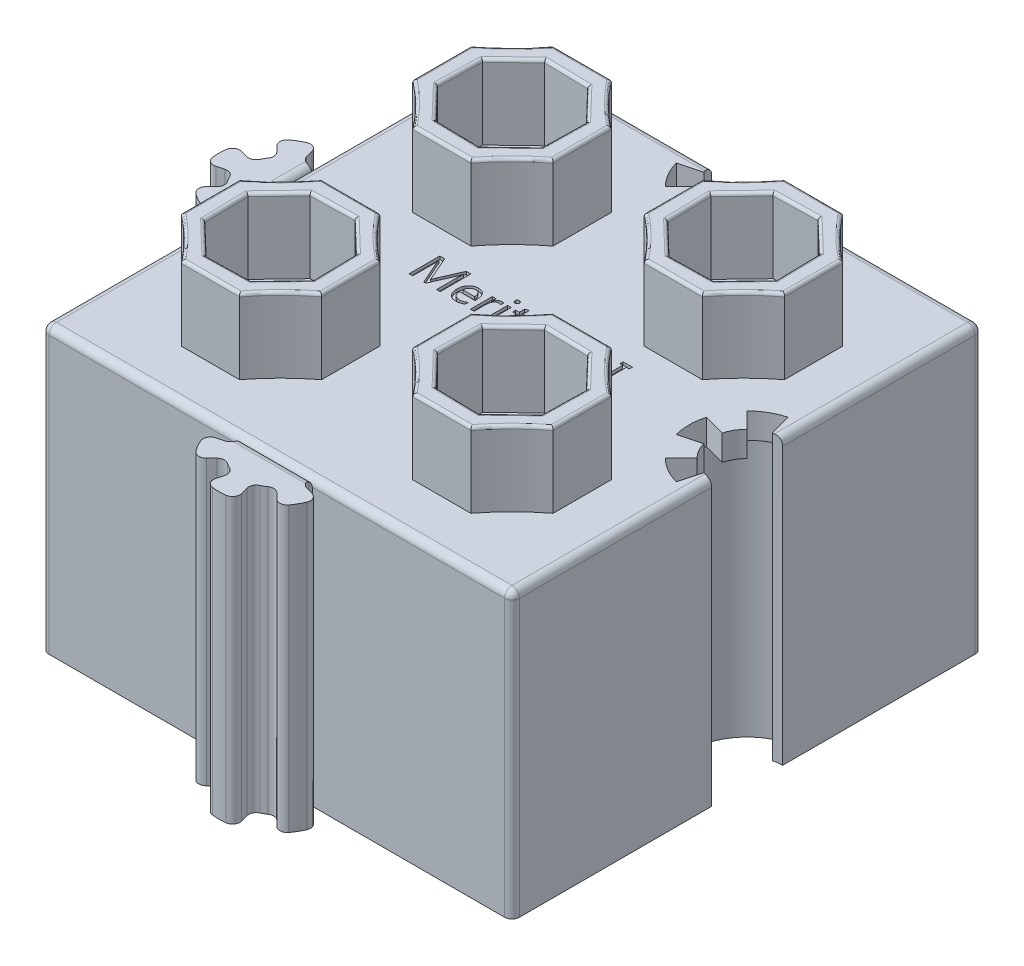
from build123d import *

# Parameters (mm, degrees)
SKETCH2_W           = 31.5
SKETCH2_H           = 31.5
BOSS_EXTRUDE1_DEPTH = 19
CUT_EXTRUDE6_DEPTH  = 30.276697218
BOSS_EXTRUDE5_DEPTH = 5
CUT_EXTRUDE8_START  = -17.3
CUT_EXTRUDE8_DEPTH  = 17.3
FILLET19_R          = 0.1
FILLET20_R          = 0.5
FILLET21_R          = 0.2
BOSS_EXTRUDE7_DEPTH = 19
FILLET24_R          = 0.5
BOSS_EXTRUDE9_START = -0.5
BOSS_EXTRUDE9_DEPTH = 18.5
FILLET31_R          = 0.5
SKETCH14_W          = 0.243314401
SKETCH14_H          = 1.459886411
CUT_EXTRUDE9_DEPTH  = 0.2


with BuildPart() as part:
    # Sketch2 → Boss-Extrude1 (new body)
    with BuildSketch(Plane(origin=(0, 0, 0), x_dir=(1, 0, 0), z_dir=(0, 1, 0))):
        Rectangle(SKETCH2_W, SKETCH2_H)
    extrude(amount=BOSS_EXTRUDE1_DEPTH)

    # Sketch5 → Cut-Extrude6 (cut, through all)
    with BuildSketch(Plane(origin=(0, 19, 0), x_dir=(1, 0, 0), z_dir=(0, 1, 0))):
        with BuildLine():
            Line((-2.740038777, 13.009961223), (-1.679378605, 14.070621395))
            ThreePointArc((-1.679378605, 14.070621395), (-2.056810334, 14.5625), (-2.294073837, 15.135304768))
            Line((-2.294073837, 15.135304768), (-3.742962577, 14.7470762))
            ThreePointArc((-3.742962577, 14.7470762), (-3.35584844, 13.8125), (-2.740038777, 13.009961223))
        make_face()
        with BuildLine():
            Line((1.0029238, 12.007037423), (0.614695232, 13.455926163))
            ThreePointArc((0.614695232, 13.455926163), (0, 13.375), (-0.614695232, 13.455926163))
            Line((-0.614695232, 13.455926163), (-1.0029238, 12.007037423))
            ThreePointArc((-1.0029238, 12.007037423), (0, 11.875), (1.0029238, 12.007037423))
        make_face()
        with BuildLine():
            ThreePointArc((2.294073837, 15.135304768), (2.056810334, 14.5625), (1.679378605, 14.070621395))
            Line((1.679378605, 14.070621395), (2.740038777, 13.009961223))
            ThreePointArc((2.740038777, 13.009961223), (3.35584844, 13.8125), (3.742962577, 14.7470762))
            Line((3.742962577, 14.7470762), (2.294073837, 15.135304768))
        make_face()
        with BuildLine():
            ThreePointArc((-0.614695232, 13.455926163), (0, 13.375), (0.614695232, 13.455926163))
            ThreePointArc((0.614695232, 13.455926163), (1.1875, 13.693189666), (1.679378605, 14.070621395))
            ThreePointArc((1.679378605, 14.070621395), (2.056810334, 14.5625), (2.294073837, 15.135304768))
            ThreePointArc((2.294073837, 15.135304768), (2.354681546, 15.440000293), (2.375, 15.75))
            Line((2.375, 15.75), (0, 15.75))
            Line((0, 15.75), (-2.375, 15.75))
            ThreePointArc((-2.375, 15.75), (-2.354681546, 15.440000293), (-2.294073837, 15.135304768))
            ThreePointArc((-2.294073837, 15.135304768), (-2.056810334, 14.5625), (-1.679378605, 14.070621395))
            ThreePointArc((-1.679378605, 14.070621395), (-1.1875, 13.693189666), (-0.614695232, 13.455926163))
        make_face()
        with BuildLine():
            Line((15.75, -2.375), (15.75, 0))
            Line((15.75, 0), (15.75, 2.375))
            ThreePointArc((15.75, 2.375), (15.440000293, 2.354681546), (15.135304768, 2.294073837))
            ThreePointArc((15.135304768, 2.294073837), (14.5625, 2.056810334), (14.070621395, 1.679378605))
            ThreePointArc((14.070621395, 1.679378605), (13.693189666, 1.1875), (13.455926163, 0.614695232))
            ThreePointArc((13.455926163, 0.614695232), (13.375, 0), (13.455926163, -0.614695232))
            ThreePointArc((13.455926163, -0.614695232), (13.693189666, -1.1875), (14.070621395, -1.679378605))
            ThreePointArc((14.070621395, -1.679378605), (14.5625, -2.056810334), (15.135304768, -2.294073837))
            ThreePointArc((15.135304768, -2.294073837), (15.440000293, -2.354681546), (15.75, -2.375))
        make_face()
        with BuildLine():
            ThreePointArc((14.070621395, 1.679378605), (14.5625, 2.056810334), (15.135304768, 2.294073837))
            Line((15.135304768, 2.294073837), (14.7470762, 3.742962577))
            ThreePointArc((14.7470762, 3.742962577), (13.8125, 3.35584844), (13.009961223, 2.740038777))
            Line((13.009961223, 2.740038777), (14.070621395, 1.679378605))
        make_face()
        with BuildLine():
            Line((12.007037423, -1.0029238), (13.455926163, -0.614695232))
            ThreePointArc((13.455926163, -0.614695232), (13.375, 0), (13.455926163, 0.614695232))
            Line((13.455926163, 0.614695232), (12.007037423, 1.0029238))
            ThreePointArc((12.007037423, 1.0029238), (11.875, 0), (12.007037423, -1.0029238))
        make_face()
        with BuildLine():
            Line((14.7470762, -3.742962577), (15.135304768, -2.294073837))
            ThreePointArc((15.135304768, -2.294073837), (14.5625, -2.056810334), (14.070621395, -1.679378605))
            Line((14.070621395, -1.679378605), (13.009961223, -2.740038777))
            ThreePointArc((13.009961223, -2.740038777), (13.8125, -3.35584844), (14.7470762, -3.742962577))
        make_face()
    extrude(amount=-CUT_EXTRUDE6_DEPTH, mode=Mode.SUBTRACT)

    # Sketch3 → Boss-Extrude5 (add)
    # profile 1 of 4: a face of its own
    with BuildSketch(Plane(origin=(0, 19, 0), x_dir=(1, 0, 0), z_dir=(0, 1, 0))):
        with BuildLine():
            Line((-9.696803743, -3.05), (-5.803196257, -3.05))
            ThreePointArc((-5.803196257, -3.05), (-4.516309736, -4.516309736), (-3.05, -5.803196257))
            Line((-3.05, -5.803196257), (-3.05, -9.696803743))
            ThreePointArc((-3.05, -9.696803743), (-4.516309736, -10.983690264), (-5.803196257, -12.45))
            Line((-5.803196257, -12.45), (-9.696803743, -12.45))
            ThreePointArc((-9.696803743, -12.45), (-10.983690264, -10.983690264), (-12.45, -9.696803743))
            Line((-12.45, -9.696803743), (-12.45, -5.803196257))
            ThreePointArc((-12.45, -5.803196257), (-10.983690264, -4.516309736), (-9.696803743, -3.05))
        make_face()
        Polygon((-9.29596592, -4.228191333), (-6.352868195, -4.166542224), (-4.228191333, -6.20403408), (-4.166542224, -9.147131805), (-6.20403408, -11.271808667), (-9.147131805, -11.333457776), (-11.271808667, -9.29596592), (-11.333457776, -6.352868195), align=None, mode=Mode.SUBTRACT)
    # profile 2 of 4: a face of its own
    with BuildSketch(Plane(origin=(0, 19, 0), x_dir=(1, 0, 0), z_dir=(0, 1, 0))):
        with BuildLine():
            Line((-3.05, 5.803196257), (-3.05, 9.696803743))
            ThreePointArc((-3.05, 9.696803743), (-4.516309736, 10.983690264), (-5.803196257, 12.45))
            Line((-5.803196257, 12.45), (-9.696803743, 12.45))
            ThreePointArc((-9.696803743, 12.45), (-10.983690264, 10.983690264), (-12.45, 9.696803743))
            Line((-12.45, 9.696803743), (-12.45, 5.803196257))
            ThreePointArc((-12.45, 5.803196257), (-10.983690264, 4.516309736), (-9.696803743, 3.05))
            Line((-9.696803743, 3.05), (-5.803196257, 3.05))
            ThreePointArc((-5.803196257, 3.05), (-4.516309736, 4.516309736), (-3.05, 5.803196257))
        make_face()
        Polygon((-6.352868195, 4.166542224), (-4.228191333, 6.20403408), (-4.166542224, 9.147131805), (-6.20403408, 11.271808667), (-9.147131805, 11.333457776), (-11.271808667, 9.29596592), (-11.333457776, 6.352868195), (-9.29596592, 4.228191333), align=None, mode=Mode.SUBTRACT)
    # profile 3 of 4: a face of its own
    with BuildSketch(Plane(origin=(0, 19, 0), x_dir=(1, 0, 0), z_dir=(0, 1, 0))):
        with BuildLine():
            Line((3.05, -5.803196257), (3.05, -9.696803743))
            ThreePointArc((3.05, -9.696803743), (4.516309736, -10.983690264), (5.803196257, -12.45))
            Line((5.803196257, -12.45), (9.696803743, -12.45))
            ThreePointArc((9.696803743, -12.45), (10.983690264, -10.983690264), (12.45, -9.696803743))
            Line((12.45, -9.696803743), (12.45, -5.803196257))
            ThreePointArc((12.45, -5.803196257), (10.983690264, -4.516309736), (9.696803743, -3.05))
            Line((9.696803743, -3.05), (5.803196257, -3.05))
            ThreePointArc((5.803196257, -3.05), (4.516309736, -4.516309736), (3.05, -5.803196257))
        make_face()
        Polygon((6.352868195, -4.166542224), (4.228191333, -6.20403408), (4.166542224, -9.147131805), (6.20403408, -11.271808667), (9.147131805, -11.333457776), (11.271808667, -9.29596592), (11.333457776, -6.352868195), (9.29596592, -4.228191333), align=None, mode=Mode.SUBTRACT)
    # profile 4 of 4: a face of its own
    with BuildSketch(Plane(origin=(0, 19, 0), x_dir=(1, 0, 0), z_dir=(0, 1, 0))):
        with BuildLine():
            Line((9.696803743, 3.05), (5.803196257, 3.05))
            ThreePointArc((5.803196257, 3.05), (4.516309736, 4.516309736), (3.05, 5.803196257))
            Line((3.05, 5.803196257), (3.05, 9.696803743))
            ThreePointArc((3.05, 9.696803743), (4.516309736, 10.983690264), (5.803196257, 12.45))
            Line((5.803196257, 12.45), (9.696803743, 12.45))
            ThreePointArc((9.696803743, 12.45), (10.983690264, 10.983690264), (12.45, 9.696803743))
            Line((12.45, 9.696803743), (12.45, 5.803196257))
            ThreePointArc((12.45, 5.803196257), (10.983690264, 4.516309736), (9.696803743, 3.05))
        make_face()
        Polygon((9.29596592, 4.228191333), (6.352868195, 4.166542224), (4.228191333, 6.20403408), (4.166542224, 9.147131805), (6.20403408, 11.271808667), (9.147131805, 11.333457776), (11.271808667, 9.29596592), (11.333457776, 6.352868195), align=None, mode=Mode.SUBTRACT)
    extrude(amount=BOSS_EXTRUDE5_DEPTH)

    # Sketch7 → Cut-Extrude8 (cut)
    with BuildSketch(Plane.XZ.offset(CUT_EXTRUDE8_START)):
        Polygon((-8.175, 14.3), (-14.3, 14.3), (-14.3, 8.175), (-12.95, 8.175), (-12.95, 6.725), (-14.3, 6.725), (-14.3, 0.6), (-8.175, 0.6), (-8.175, 3.2), (-7.45, 3.2), (-6.725, 3.2), (-6.725, 0.6), (-0.55600988, 0.6), (-0.55600988, 6.725), (-3.2, 6.725), (-3.2, 7.45), (-3.2, 8.175), (-0.55600988, 8.175), (-0.55600988, 14.3), (-6.725, 14.3), (-6.725, 12.95), (-8.175, 12.95), align=None)
        Polygon((6.721665956, 14.3), (0.6, 14.3), (0.6, 8.175), (3.2, 8.175), (3.2, 7.45), (3.2, 6.725), (0.6, 6.725), (0.6, 0.6), (6.725, 0.6), (6.725, 3.2), (7.45, 3.2), (8.175, 3.2), (8.175, 0.6), (14.3, 0.6), (14.3, 6.725), (12.95, 6.725), (12.95, 7.45), (12.95, 8.175), (14.3, 8.175), (14.3, 14.3), (8.171665956, 14.3), (8.171665956, 12.95), (6.721665956, 12.95), align=None)
        with BuildLine():
            ThreePointArc((12.007037423, -1.0029238), (11.959028537, -0.802596019), (11.921733421, -0.6))
            Line((11.921733421, -0.6), (8.175, -0.6))
            Line((8.175, -0.6), (8.175, -3.2))
            Line((8.175, -3.2), (6.725, -3.2))
            Line((6.725, -3.2), (6.725, -0.6))
            Line((6.725, -0.6), (0.6, -0.6))
            Line((0.6, -0.6), (0.6, -6.725))
            Line((0.6, -6.725), (3.2, -6.725))
            Line((3.2, -6.725), (3.2, -7.45))
            Line((3.2, -7.45), (3.2, -8.175))
            Line((3.2, -8.175), (0.6, -8.175))
            Line((0.6, -8.175), (0.6, -11.921733421))
            ThreePointArc((0.6, -11.921733421), (0.802596019, -11.959028537), (1.0029238, -12.007037423))
            Line((1.0029238, -12.007037423), (0.614695232, -13.455926163))
            ThreePointArc((0.614695232, -13.455926163), (1.1875, -13.693189666), (1.679378605, -14.070621395))
            Line((1.679378605, -14.070621395), (2.740038777, -13.009961223))
            ThreePointArc((2.740038777, -13.009961223), (3.231783828, -13.611963917), (3.593483686, -14.3))
            Line((3.593483686, -14.3), (3.825102639, -14.3))
            Line((3.825102639, -14.3), (6.721665956, -14.3))
            Line((6.721665956, -14.3), (6.721665956, -12.95))
            Line((6.721665956, -12.95), (8.171665956, -12.95))
            Line((8.171665956, -12.95), (8.171665956, -14.3))
            Line((8.171665956, -14.3), (14.3, -14.3))
            Line((14.3, -14.3), (14.3, -8.175))
            Line((14.3, -8.175), (12.95, -8.175))
            Line((12.95, -8.175), (12.95, -7.45))
            Line((12.95, -7.45), (12.95, -6.725))
            Line((12.95, -6.725), (14.3, -6.725))
            Line((14.3, -6.725), (14.3, -3.593483686))
            ThreePointArc((14.3, -3.593483686), (13.611963917, -3.231783828), (13.009961223, -2.740038777))
            Line((13.009961223, -2.740038777), (14.070621395, -1.679378605))
            ThreePointArc((14.070621395, -1.679378605), (13.693189666, -1.1875), (13.455926163, -0.614695232))
            Line((13.455926163, -0.614695232), (12.007037423, -1.0029238))
        make_face()
        with BuildLine():
            Line((-6.725, -14.3), (-3.593483686, -14.3))
            ThreePointArc((-3.593483686, -14.3), (-3.231783828, -13.611963917), (-2.740038777, -13.009961223))
            Line((-2.740038777, -13.009961223), (-1.679378605, -14.070621395))
            ThreePointArc((-1.679378605, -14.070621395), (-1.1875, -13.693189666), (-0.614695232, -13.455926163))
            Line((-0.614695232, -13.455926163), (-1.0029238, -12.007037423))
            ThreePointArc((-1.0029238, -12.007037423), (-0.780821232, -11.954483803), (-0.55600988, -11.915097392))
            Line((-0.55600988, -11.915097392), (-0.55600988, -8.175))
            Line((-0.55600988, -8.175), (-3.2, -8.175))
            Line((-3.2, -8.175), (-3.2, -7.45))
            Line((-3.2, -7.45), (-3.2, -6.725))
            Line((-3.2, -6.725), (-0.55600988, -6.725))
            Line((-0.55600988, -6.725), (-0.55600988, -0.6))
            Line((-0.55600988, -0.6), (-6.725, -0.6))
            Line((-6.725, -0.6), (-6.725, -3.2))
            Line((-6.725, -3.2), (-8.175, -3.2))
            Line((-8.175, -3.2), (-8.175, -0.6))
            Line((-8.175, -0.6), (-14.3, -0.6))
            Line((-14.3, -0.6), (-14.3, -5.275))
            Line((-14.3, -5.275), (-14.3, -6.725))
            Line((-14.3, -6.725), (-12.95, -6.725))
            Line((-12.95, -6.725), (-12.95, -7.45))
            Line((-12.95, -7.45), (-12.95, -8.175))
            Line((-12.95, -8.175), (-14.3, -8.175))
            Line((-14.3, -8.175), (-14.3, -14.3))
            Line((-14.3, -14.3), (-8.175, -14.3))
            Line((-8.175, -14.3), (-8.175, -12.95))
            Line((-8.175, -12.95), (-6.725, -12.95))
            Line((-6.725, -12.95), (-6.725, -14.3))
        make_face()
    extrude(amount=CUT_EXTRUDE8_DEPTH, mode=Mode.SUBTRACT)

    # Fillet19
    fillet19_edges = [part.edges().sort_by_distance(p)[0] for p in [
        (-3.2, 0, -7.45),
        (-3.2, 8.65, -6.725),
        (-3.2, 8.65, -8.175),
        (-6.725, 8.65, -12.95),
        (-8.175, 8.65, -12.95),
        (-12.95, 0, -7.45),
        (-12.95, 8.65, -8.175),
        (-12.95, 8.65, -6.725),
        (-8.175, 8.65, -3.2),
        (-6.725, 8.65, -3.2),
        (-7.45, 0, -3.2),
        (-7.45, 0, -12.95),
        (7.446665956, 0, -12.95),
        (8.171665956, 8.65, -12.95),
        (6.721665956, 8.65, -12.95),
        (3.2, 8.65, -8.175),
        (3.2, 8.65, -6.725),
        (7.45, 0, -3.2),
        (6.725, 8.65, -3.2),
        (8.175, 8.65, -3.2),
        (12.95, 8.65, -6.725),
        (12.95, 8.65, -8.175),
        (12.95, 0, -7.45),
        (3.2, 0, -7.45),
        (7.45, 0, 3.2),
        (8.175, 8.65, 3.2),
        (6.725, 8.65, 3.2),
        (3.2, 8.65, 6.725),
        (3.2, 8.65, 8.175),
        (6.721665956, 8.65, 12.95),
        (8.171665956, 8.65, 12.95),
        (12.95, 8.65, 8.175),
        (12.95, 8.65, 6.725),
        (12.95, 0, 7.45),
        (7.446665956, 0, 12.95),
        (3.2, 0, 7.45),
        (-12.95, 0, 7.45),
        (-12.95, 8.65, 6.725),
        (-12.95, 8.65, 8.175),
        (-7.45, 0, 12.95),
        (-8.175, 8.65, 12.95),
        (-6.725, 8.65, 12.95),
        (-3.2, 0, 7.45),
        (-3.2, 8.65, 8.175),
        (-3.2, 8.65, 6.725),
        (-7.45, 0, 3.2),
        (-6.725, 8.65, 3.2),
        (-8.175, 8.65, 3.2),
    ]]
    fillet(fillet19_edges, radius=FILLET19_R)

    # Fillet20
    fillet20_edges = [part.edges().sort_by_distance(p)[0] for p in [
        (-15.75, 19, 0),
        (0, 19, 15.75),
        (15.75, 19, -9.0625),
        (-9.0625, 19, -15.75),
        (15.75, 19, 9.0625),
        (15.75, 9.5, 15.75),
        (-15.75, 9.5, 15.75),
        (-15.75, 9.5, -15.75),
        (15.75, 9.5, -15.75),
        (9.0625, 19, -15.75),
    ]]
    fillet(fillet20_edges, radius=FILLET20_R)

    # Fillet21
    fillet21_edges = [part.edges().sort_by_distance(p)[0] for p in [
        (-4.516309736, 24, 4.516309736),
        (-7.75, 24, 3.05),
        (-10.983690264, 24, 4.516309736),
        (-12.45, 24, 7.75),
        (-10.983690264, 24, 10.983690264),
        (-7.75, 24, 12.45),
        (-4.516309736, 24, 10.983690264),
        (-3.05, 24, 7.75),
        (-10.314711848, 24, 5.290529764),
        (-11.302633221, 24, 7.824417058),
        (-10.209470236, 24, 10.314711848),
        (-7.675582942, 24, 11.302633221),
        (-5.185288152, 24, 10.209470236),
        (-4.197366779, 24, 7.675582942),
        (-5.290529764, 24, 5.185288152),
        (-7.824417058, 24, 4.197366779),
        (-4.516309736, 24, -4.516309736),
        (-3.05, 24, -7.75),
        (-4.516309736, 24, -10.983690264),
        (-7.75, 24, -12.45),
        (-10.983690264, 24, -10.983690264),
        (-12.45, 24, -7.75),
        (-10.983690264, 24, -4.516309736),
        (-7.75, 24, -3.05),
        (-7.824417058, 24, -4.197366779),
        (-5.290529764, 24, -5.185288152),
        (-4.197366779, 24, -7.675582942),
        (-5.185288152, 24, -10.209470236),
        (-7.675582942, 24, -11.302633221),
        (-10.209470236, 24, -10.314711848),
        (-11.302633221, 24, -7.824417058),
        (-10.314711848, 24, -5.290529764),
        (10.983690264, 24, 10.983690264),
        (12.45, 24, 7.75),
        (10.983690264, 24, 4.516309736),
        (7.75, 24, 3.05),
        (4.516309736, 24, 4.516309736),
        (3.05, 24, 7.75),
        (4.516309736, 24, 10.983690264),
        (7.75, 24, 12.45),
        (7.824417058, 24, 4.197366779),
        (5.290529764, 24, 5.185288152),
        (4.197366779, 24, 7.675582942),
        (5.185288152, 24, 10.209470236),
        (7.675582942, 24, 11.302633221),
        (10.209470236, 24, 10.314711848),
        (11.302633221, 24, 7.824417058),
        (10.314711848, 24, 5.290529764),
        (4.516309736, 24, -4.516309736),
        (7.75, 24, -3.05),
        (10.983690264, 24, -4.516309736),
        (12.45, 24, -7.75),
        (10.983690264, 24, -10.983690264),
        (7.75, 24, -12.45),
        (4.516309736, 24, -10.983690264),
        (3.05, 24, -7.75),
        (10.314711848, 24, -5.290529764),
        (11.302633221, 24, -7.824417058),
        (10.209470236, 24, -10.314711848),
        (7.675582942, 24, -11.302633221),
        (5.185288152, 24, -10.209470236),
        (4.197366779, 24, -7.675582942),
        (5.290529764, 24, -5.185288152),
        (7.824417058, 24, -4.197366779),
    ]]
    fillet(fillet21_edges, radius=FILLET21_R)

    # Sketch6 → Boss-Extrude7 (add, through all)
    with BuildSketch(Plane(origin=(0, 19, 0), x_dir=(1, 0, 0), z_dir=(0, 1, 0))):
        with BuildLine():
            ThreePointArc((-2.375, -15.75), (-2.354681546, -16.059999707), (-2.294073837, -16.364695232))
            Line((-2.294073837, -16.364695232), (-3.742962577, -16.7529238))
            ThreePointArc((-3.742962577, -16.7529238), (-3.35584844, -17.6875), (-2.740038777, -18.490038777))
            Line((-2.740038777, -18.490038777), (-1.679378605, -17.429378605))
            ThreePointArc((-1.679378605, -17.429378605), (-1.189926656, -17.805407393), (-0.620108527, -18.0426165))
            Line((-0.620108527, -18.0426165), (-1.011756018, -19.490584815))
            ThreePointArc((-1.011756018, -19.490584815), (0, -19.625), (1.011756018, -19.490584815))
            Line((1.011756018, -19.490584815), (0.620108527, -18.0426165))
            ThreePointArc((0.620108527, -18.0426165), (1.189926656, -17.805407393), (1.679378605, -17.429378605))
            Line((1.679378605, -17.429378605), (2.740038777, -18.490038777))
            ThreePointArc((2.740038777, -18.490038777), (3.35584844, -17.6875), (3.742962577, -16.7529238))
            Line((3.742962577, -16.7529238), (2.294073837, -16.364695232))
            ThreePointArc((2.294073837, -16.364695232), (2.354681546, -16.059999707), (2.375, -15.75))
            Line((2.375, -15.75), (-2.375, -15.75))
        make_face()
        with BuildLine():
            Line((-15.75, -2.375), (-15.75, 2.375))
            ThreePointArc((-15.75, 2.375), (-16.059999707, 2.354681546), (-16.364695232, 2.294073837))
            Line((-16.364695232, 2.294073837), (-16.7529238, 3.742962577))
            ThreePointArc((-16.7529238, 3.742962577), (-17.6875, 3.35584844), (-18.490038777, 2.740038777))
            Line((-18.490038777, 2.740038777), (-17.429378605, 1.679378605))
            ThreePointArc((-17.429378605, 1.679378605), (-17.806810334, 1.1875), (-18.044073837, 0.614695232))
            Line((-18.044073837, 0.614695232), (-19.492962577, 1.0029238))
            ThreePointArc((-19.492962577, 1.0029238), (-19.625, 0), (-19.492962577, -1.0029238))
            Line((-19.492962577, -1.0029238), (-18.044073837, -0.614695232))
            ThreePointArc((-18.044073837, -0.614695232), (-17.806810334, -1.1875), (-17.429378605, -1.679378605))
            Line((-17.429378605, -1.679378605), (-18.490038777, -2.740038777))
            ThreePointArc((-18.490038777, -2.740038777), (-17.6875, -3.35584844), (-16.7529238, -3.742962577))
            Line((-16.7529238, -3.742962577), (-16.364695232, -2.294073837))
            ThreePointArc((-16.364695232, -2.294073837), (-16.059999707, -2.354681546), (-15.75, -2.375))
        make_face()
    extrude(amount=-BOSS_EXTRUDE7_DEPTH)

    # Fillet24
    fillet24_edges = [part.edges().sort_by_distance(p)[0] for p in [
        (-16.364695232, 9.5, 2.294073837),
        (-16.7529238, 9.5, 3.742962577),
        (-18.490038777, 9.5, 2.740038777),
        (-17.429378605, 9.5, 1.679378605),
        (-18.044073837, 9.5, 0.614695232),
        (-19.492962577, 9.5, 1.0029238),
        (-19.492962577, 9.5, -1.0029238),
        (-18.044073837, 9.5, -0.614695232),
        (-17.429378605, 9.5, -1.679378605),
        (-18.490038777, 9.5, -2.740038777),
        (-16.7529238, 9.5, -3.742962577),
        (-16.364695232, 9.5, -2.294073837),
        (0.620108527, 9.5, 18.0426165),
        (1.011756018, 9.5, 19.490584815),
        (-1.011756018, 9.5, 19.490584815),
        (-0.620108527, 9.5, 18.0426165),
        (-1.679378605, 9.5, 17.429378605),
        (-2.740038777, 9.5, 18.490038777),
        (-3.742962577, 9.5, 16.7529238),
        (-2.294073837, 9.5, 16.364695232),
        (2.294073837, 9.5, 16.364695232),
        (3.742962577, 9.5, 16.7529238),
        (2.740038777, 9.5, 18.490038777),
        (1.679378605, 9.5, 17.429378605),
    ]]
    fillet(fillet24_edges, radius=FILLET24_R)

    # Sketch10 → Boss-Extrude9 (add, through all)
    with BuildSketch(Plane(origin=(0, 19, 0), x_dir=(1, 0, 0), z_dir=(0, 1, 0)).offset(BOSS_EXTRUDE9_START)):
        with BuildLine():
            Line((15.75, 4.35), (15.75, 4))
            ThreePointArc((15.75, 4), (11.75, 0), (15.75, -4))
            Line((15.75, -4), (15.75, -4.35))
            ThreePointArc((15.75, -4.35), (11.4, 0), (15.75, 4.35))
        make_face()
        with BuildLine():
            Line((-4.35, 15.75), (-4, 15.75))
            ThreePointArc((-4, 15.75), (0, 11.75), (4, 15.75))
            Line((4, 15.75), (4.35, 15.75))
            ThreePointArc((4.35, 15.75), (0, 11.4), (-4.35, 15.75))
        make_face()
    extrude(amount=-BOSS_EXTRUDE9_DEPTH)

    # Fillet31
    fillet31_edges = [part.edges().sort_by_distance(p)[0] for p in [
        (0, 19, 15.75),
        (-15.75, 19, 0),
    ]]
    fillet(fillet31_edges, radius=FILLET31_R - 0.0001)  # a hair under: the kernel refuses the full size

    # Sketch14 → Cut-Extrude9 (cut)
    # profile 1 of 10: a face of its own
    with BuildSketch(Plane(origin=(0, 19, 0), x_dir=(1, 0, 0), z_dir=(0, 1, 0))):
        with BuildLine():
            Line((-4.185446251, -0.622549055), (-4.428760652, -0.622549055))
            Line((-4.428760652, -0.622549055), (-4.428760652, 0.755810134))
            add(Edge.make_bspline(
                [(-4.428760652, 0.755810134), (-4.428365689, 0.784539456), (-4.427532733, 0.845127912), (-4.422682577, 0.94049853), (-4.414521533, 1.044985373), (-4.407223232, 1.117556728), (-4.403415402, 1.155420246)],
                knots=[0, 0, 0, 0, 0.860661636, 1.815085004, 2.860038273, 4, 4, 4, 4], degree=3))
            Line((-4.403415402, 1.155420246), (-4.408906873, 1.155420246))
            add(Edge.make_bspline(
                [(-4.408906873, 1.155420246), (-4.414198459, 1.133821485), (-4.423997009, 1.093826573), (-4.440377852, 1.039347496), (-4.454566575, 0.994259532), (-4.465360223, 0.968091477), (-4.470157894, 0.956460032)],
                knots=[0, 0, 0, 0, 1.280239489, 2.370648261, 3.275769024, 4, 4, 4, 4], degree=3))
            Line((-4.470157894, 0.956460032), (-5.167997116, -0.622549055))
            Line((-5.167997116, -0.622549055), (-5.284585267, -0.622549055))
            Line((-5.284585267, -0.622549055), (-5.980734805, 0.944632248))
            add(Edge.make_bspline(
                [(-5.980734805, 0.944632248), (-5.985984983, 0.957520699), (-5.997588407, 0.986005476), (-6.012303896, 1.034429024), (-6.027366838, 1.091839682), (-6.036895975, 1.133283581), (-6.041985826, 1.155420246)],
                knots=[0, 0, 0, 0, 0.759466544, 1.678497715, 2.760002834, 4, 4, 4, 4], degree=3))
            Line((-6.041985826, 1.155420246), (-6.047899718, 1.155420246))
            add(Edge.make_bspline(
                [(-6.047899718, 1.155420246), (-6.046004329, 1.144306737), (-6.041959435, 1.120589729), (-6.036906808, 1.082422339), (-6.032794544, 1.039445078), (-6.02945169, 0.991554364), (-6.026939276, 0.938738221), (-6.025445076, 0.880992671), (-6.024005304, 0.818476013), (-6.023884362, 0.775242489), (-6.02382173, 0.752853189)],
                knots=[0, 0, 0, 0, 0.67007234, 1.42998148, 2.28774986, 3.235855594, 4.283231119, 5.430323186, 6.669244132, 8, 8, 8, 8], degree=3))
            Line((-6.02382173, 0.752853189), (-6.02382173, -0.622549055))
            Line((-6.02382173, -0.622549055), (-6.267136132, -0.622549055))
            Line((-6.267136132, -0.622549055), (-6.267136132, 1.432105893))
            Line((-6.267136132, 1.432105893), (-5.938070301, 1.432105893))
            Line((-5.938070301, 1.432105893), (-5.319646196, -0.000745583))
            add(Edge.make_bspline(
                [(-5.319646196, -0.000745583), (-5.308469186, -0.02643496), (-5.287755815, -0.074042828), (-5.261864394, -0.141026445), (-5.24067649, -0.197005138), (-5.231016918, -0.231603487), (-5.226713612, -0.247016931)],
                knots=[0, 0, 0, 0, 1.275894141, 2.364502614, 3.271391623, 4, 4, 4, 4], degree=3))
            Line((-5.226713612, -0.247016931), (-5.218265195, -0.247016931))
            add(Edge.make_bspline(
                [(-5.218265195, -0.247016931), (-5.208757444, -0.220661127), (-5.190978356, -0.171376898), (-5.165180121, -0.102952296), (-5.142696996, -0.045074415), (-5.127809501, -0.010427029), (-5.121108403, 0.005168308)],
                knots=[0, 0, 0, 0, 1.243852458, 2.325950982, 3.246484013, 4, 4, 4, 4], degree=3))
            Line((-5.121108403, 0.005168308), (-4.490011674, 1.432105893))
            Line((-4.490011674, 1.432105893), (-4.185446251, 1.432105893))
            Line((-4.185446251, 1.432105893), (-4.185446251, -0.622549055))
        make_face()
    # profile 2 of 10: a face of its own
    with BuildSketch(Plane(origin=(0, 19, 0), x_dir=(1, 0, 0), z_dir=(0, 1, 0))):
        with BuildLine():
            Line((-2.509280372, 0.02628935), (-3.536607846, 0.02628935))
            add(Edge.make_bspline(
                [(-3.536607846, 0.02628935), (-3.535741202, 0.007401385), (-3.534054571, -0.029357705), (-3.527256682, -0.082895857), (-3.51692561, -0.13312956), (-3.502386966, -0.180043665), (-3.484477561, -0.223658837), (-3.462106773, -0.263630848), (-3.436852567, -0.300697364), (-3.407606801, -0.334122179), (-3.374940036, -0.363802372), (-3.339285697, -0.389541109), (-3.301001557, -0.411975689), (-3.259388755, -0.42937845), (-3.215088607, -0.443682529), (-3.167722892, -0.453002203), (-3.117585824, -0.459137536), (-3.083228835, -0.459932005), (-3.065608613, -0.460339453)],
                knots=[0, 0, 0, 0, 1.184408581, 2.305054099, 3.377930031, 4.393781937, 5.378582561, 6.326405153, 7.258867486, 8.184332429, 9.102492345, 10.018445142, 10.935544606, 11.876277185, 12.838972485, 13.847788069, 14.896223044, 16, 16, 16, 16], degree=3))
            add(Edge.make_bspline(
                [(-3.065608613, -0.460339453), (-3.045448962, -0.459860252), (-3.005407621, -0.458908458), (-2.946040962, -0.451024819), (-2.887940945, -0.438385571), (-2.831127895, -0.420532999), (-2.775572138, -0.397647484), (-2.721324151, -0.369431531), (-2.667927403, -0.336778837), (-2.634383266, -0.311110331), (-2.617420106, -0.298129852)],
                knots=[0, 0, 0, 0, 0.995265489, 1.976808256, 2.952049592, 3.928554468, 4.91385875, 5.915299678, 6.945773892, 8, 8, 8, 8], degree=3))
            Line((-2.617420106, -0.298129852), (-2.617420106, -0.487374387))
            add(Edge.make_bspline(
                [(-2.617420106, -0.487374387), (-2.633787631, -0.500389511), (-2.666498881, -0.526400834), (-2.720363256, -0.559473927), (-2.777996664, -0.587364126), (-2.839544186, -0.610195022), (-2.904872066, -0.627919995), (-2.973973632, -0.640456789), (-3.046844582, -0.648216591), (-3.096707109, -0.649121239), (-3.122213006, -0.649583988)],
                knots=[0, 0, 0, 0, 0.926160969, 1.850975283, 2.7943853, 3.760012562, 4.756193179, 5.790524795, 6.869799656, 8, 8, 8, 8], degree=3))
            add(Edge.make_bspline(
                [(-3.122213006, -0.649583988), (-3.147165378, -0.649075455), (-3.195845244, -0.648083351), (-3.266751784, -0.638637636), (-3.333504964, -0.622959215), (-3.396279278, -0.601463753), (-3.45506717, -0.573941476), (-3.509570844, -0.539942002), (-3.559555449, -0.499319082), (-3.605912984, -0.453411161), (-3.646575195, -0.40111945), (-3.6830675, -0.344318212), (-3.712794032, -0.281832703), (-3.737279762, -0.214599996), (-3.756930829, -0.142595553), (-3.769873888, -0.065460802), (-3.778850369, 0.016502968), (-3.779557851, 0.072870079), (-3.779922248, 0.10190268)],
                knots=[0, 0, 0, 0, 1.057360178, 2.062815899, 3.025640715, 3.960051138, 4.870591455, 5.771592525, 6.6758502, 7.595985763, 8.531025142, 9.478236304, 10.452684885, 11.457342956, 12.508586193, 13.611630498, 14.769839786, 16, 16, 16, 16], degree=3))
            add(Edge.make_bspline(
                [(-3.779922248, 0.10190268), (-3.779434114, 0.129391985), (-3.778477432, 0.183267638), (-3.768631493, 0.262020013), (-3.754380626, 0.337088474), (-3.732943484, 0.4079942), (-3.706045742, 0.475231256), (-3.672297626, 0.538209885), (-3.633545017, 0.59789422), (-3.588231915, 0.652471093), (-3.538862122, 0.701960986), (-3.486059815, 0.745565786), (-3.430372135, 0.782460788), (-3.371436136, 0.812226634), (-3.309833883, 0.835543492), (-3.245349382, 0.852656431), (-3.177705746, 0.86236714), (-3.131677279, 0.863696399), (-3.108273118, 0.864372289)],
                knots=[0, 0, 0, 0, 1.159926435, 2.273313024, 3.345865063, 4.382138576, 5.395499138, 6.398026558, 7.393869797, 8.394756836, 9.386760322, 10.341220141, 11.280998387, 12.200843161, 13.122721762, 14.05705077, 15.012065776, 16, 16, 16, 16], degree=3))
            add(Edge.make_bspline(
                [(-3.108273118, 0.864372289), (-3.085150283, 0.863836381), (-3.03999395, 0.862789812), (-2.974200999, 0.853697502), (-2.912392456, 0.839182481), (-2.854700742, 0.818300943), (-2.801250821, 0.791450413), (-2.751264438, 0.759353194), (-2.705870818, 0.720523341), (-2.66495631, 0.675894171), (-2.628046631, 0.626487038), (-2.596385081, 0.571926751), (-2.569164905, 0.513015229), (-2.547474546, 0.449356952), (-2.529930845, 0.381335195), (-2.517975526, 0.308675563), (-2.510738117, 0.231451825), (-2.509775084, 0.178518097), (-2.509280372, 0.151325918)],
                knots=[0, 0, 0, 0, 1.050748146, 2.051994677, 3.013044998, 3.932365711, 4.834113508, 5.727186062, 6.626317289, 7.541349186, 8.474648056, 9.424289574, 10.403836321, 11.420071615, 12.477350798, 13.593892201, 14.763976829, 16, 16, 16, 16], degree=3))
            Line((-2.509280372, 0.151325918), (-2.509280372, 0.02628935))
        make_face()
        with BuildLine():
            add(Edge.make_bspline(
                [(-2.752594774, 0.242568818), (-2.752946651, 0.259192669), (-2.753630963, 0.291521788), (-2.758132475, 0.338593365), (-2.766412466, 0.38269095), (-2.776688606, 0.424190702), (-2.79028005, 0.46278531), (-2.806621129, 0.498650603), (-2.826828926, 0.531173992), (-2.848981953, 0.561283919), (-2.874064247, 0.588098118), (-2.901662685, 0.611340279), (-2.931371893, 0.631510062), (-2.963771605, 0.647647777), (-2.998615336, 0.659779139), (-3.035550999, 0.668594149), (-3.074721984, 0.67435004), (-3.101634127, 0.674863882), (-3.115454272, 0.675127755)],
                knots=[0, 0, 0, 0, 1.248920434, 2.428829351, 3.54714914, 4.616991953, 5.637371097, 6.617021428, 7.571271557, 8.50848436, 9.421506946, 10.322190821, 11.214073319, 12.112891779, 13.032934197, 13.979650035, 14.962493275, 16, 16, 16, 16], degree=3))
            add(Edge.make_bspline(
                [(-3.115454272, 0.675127755), (-3.128998354, 0.674895538), (-3.155660225, 0.674438414), (-3.194650713, 0.668068505), (-3.232097939, 0.659001038), (-3.267892549, 0.645689159), (-3.302281114, 0.628691309), (-3.335123581, 0.608037239), (-3.366463388, 0.583612694), (-3.39551186, 0.555390852), (-3.423107523, 0.524735344), (-3.447718976, 0.491193304), (-3.469018522, 0.455179953), (-3.48841231, 0.41722044), (-3.504678058, 0.376900681), (-3.518204961, 0.334226905), (-3.529422335, 0.289402614), (-3.534180929, 0.258387004), (-3.536607846, 0.242568818)],
                knots=[0, 0, 0, 0, 0.980868683, 1.93086499, 2.856863125, 3.770910936, 4.693131197, 5.633479823, 6.578967759, 7.56814164, 8.565969416, 9.56645689, 10.578388939, 11.596481345, 12.6542835, 13.726129948, 14.840309832, 16, 16, 16, 16], degree=3))
            Line((-3.536607846, 0.242568818), (-2.752594774, 0.242568818))
        make_face(mode=Mode.SUBTRACT)
    # profile 3 of 10: a face of its own
    with BuildSketch(Plane(origin=(0, 19, 0), x_dir=(1, 0, 0), z_dir=(0, 1, 0))):
        with BuildLine():
            add(Edge.make_bspline(
                [(-1.400848098, 0.628239042), (-1.411551412, 0.635675187), (-1.433869709, 0.65118086), (-1.474974456, 0.66464661), (-1.521804251, 0.673783054), (-1.555397331, 0.674662044), (-1.573195799, 0.675127755)],
                knots=[0, 0, 0, 0, 0.856367223, 1.785676614, 2.826795193, 4, 4, 4, 4], degree=3))
            add(Edge.make_bspline(
                [(-1.573195799, 0.675127755), (-1.585055446, 0.674760551), (-1.60855156, 0.674033054), (-1.643119754, 0.667015381), (-1.676123958, 0.655488835), (-1.70796622, 0.63989747), (-1.737307685, 0.618602448), (-1.766212585, 0.594171169), (-1.792481023, 0.564106313), (-1.817885096, 0.530618668), (-1.840608679, 0.492934048), (-1.860449382, 0.451758628), (-1.877396713, 0.407416701), (-1.890667489, 0.359670714), (-1.901858258, 0.308965419), (-1.909319956, 0.254728058), (-1.913367125, 0.197291532), (-1.914124223, 0.157950061), (-1.914511834, 0.137808451)],
                knots=[0, 0, 0, 0, 0.80504586, 1.594941963, 2.384606289, 3.17612293, 3.993579142, 4.841374672, 5.742345338, 6.699039941, 7.694967754, 8.726158507, 9.801110372, 10.915485066, 12.090156448, 13.32677443, 14.631391609, 16, 16, 16, 16], degree=3))
            Line((-1.914511834, 0.137808451), (-1.914511834, -0.622549055))
            Line((-1.914511834, -0.622549055), (-2.157826236, -0.622549055))
            Line((-2.157826236, -0.622549055), (-2.157826236, 0.837337356))
            Line((-2.157826236, 0.837337356), (-1.914511834, 0.837337356))
            Line((-1.914511834, 0.837337356), (-1.914511834, 0.53657372))
            Line((-1.914511834, 0.53657372), (-1.909020364, 0.53657372))
            add(Edge.make_bspline(
                [(-1.909020364, 0.53657372), (-1.900471152, 0.561175858), (-1.883935026, 0.608762002), (-1.849986398, 0.674111024), (-1.808896861, 0.730428031), (-1.762612249, 0.778564454), (-1.711079735, 0.816798113), (-1.655801998, 0.844397228), (-1.59726064, 0.861198763), (-1.557110489, 0.863308569), (-1.536867607, 0.864372289)],
                knots=[0, 0, 0, 0, 1.174517175, 2.271784099, 3.309087245, 4.311318047, 5.274817319, 6.190007915, 7.08743911, 8, 8, 8, 8], degree=3))
            add(Edge.make_bspline(
                [(-1.536867607, 0.864372289), (-1.522926099, 0.864056419), (-1.496699008, 0.863462195), (-1.459895164, 0.8610393), (-1.428357888, 0.855152265), (-1.409535713, 0.849321759), (-1.400848098, 0.846630614)],
                knots=[0, 0, 0, 0, 1.214538903, 2.284818904, 3.208336209, 4, 4, 4, 4], degree=3))
            Line((-1.400848098, 0.846630614), (-1.400848098, 0.628239042))
        make_face()
    # profile 4 of 10: a face of its own
    with BuildSketch(Plane(origin=(0, 19, 0), x_dir=(1, 0, 0), z_dir=(0, 1, 0))):
        with BuildLine():
            add(Edge.make_bspline(
                [(-1.010108824, 1.215826425), (-1.020029147, 1.216237407), (-1.039376169, 1.21703892), (-1.067051294, 1.225588812), (-1.09241844, 1.238894837), (-1.1150981, 1.257043621), (-1.134219759, 1.27905007), (-1.147369892, 1.304953773), (-1.156481756, 1.333213404), (-1.15717608, 1.35331847), (-1.157533696, 1.363673718)],
                knots=[0, 0, 0, 0, 1.019912547, 1.989075213, 2.956605651, 3.958695843, 4.968015385, 5.935545822, 6.936689207, 8, 8, 8, 8], degree=3))
            add(Edge.make_bspline(
                [(-1.157533696, 1.363673718), (-1.157181016, 1.37403112), (-1.156496276, 1.39414037), (-1.147277526, 1.422490226), (-1.134247883, 1.448701254), (-1.115118557, 1.471135758), (-1.092431438, 1.489664197), (-1.067162442, 1.503524664), (-1.039363686, 1.51197275), (-1.020024916, 1.512791086), (-1.010108824, 1.513210694)],
                knots=[0, 0, 0, 0, 1.058030232, 2.054201789, 3.029737676, 4.045099057, 5.051274261, 6.020802832, 6.985152492, 8, 8, 8, 8], degree=3))
            add(Edge.make_bspline(
                [(-1.010108824, 1.513210694), (-1.000056015, 1.512775612), (-0.980313361, 1.511921157), (-0.951931369, 1.503606348), (-0.926150942, 1.489801249), (-0.903404862, 1.471005538), (-0.88390286, 1.448736128), (-0.870329428, 1.422596223), (-0.861212904, 1.394128725), (-0.860510965, 1.374027161), (-0.860149427, 1.363673718)],
                knots=[0, 0, 0, 0, 1.020203202, 2.003571126, 2.97719679, 3.974537385, 4.990209237, 5.963834901, 6.951259684, 8, 8, 8, 8], degree=3))
            add(Edge.make_bspline(
                [(-0.860149427, 1.363673718), (-0.860513107, 1.353736998), (-0.86122388, 1.334316779), (-0.870530753, 1.306653716), (-0.883856819, 1.280680482), (-0.903572245, 1.25853163), (-0.925870158, 1.239068214), (-0.952152576, 1.226094964), (-0.980211962, 1.216945987), (-1.000035318, 1.216203653), (-1.010108824, 1.215826425)],
                knots=[0, 0, 0, 0, 1.014006473, 1.981763433, 2.963199614, 3.987019282, 5.001539202, 5.976266633, 6.971612632, 8, 8, 8, 8], degree=3))
        make_face()
    # profile 5 of 10: a face of its own
    with BuildSketch(Plane(origin=(0, 19, 0), x_dir=(1, 0, 0), z_dir=(0, 1, 0))):
        with Locations((-1.008841562, 0.107394151)):
            Rectangle(SKETCH14_W, SKETCH14_H)
    # profile 6 of 10: a face of its own
    with BuildSketch(Plane(origin=(0, 19, 0), x_dir=(1, 0, 0), z_dir=(0, 1, 0))):
        with BuildLine():
            add(Edge.make_bspline(
                [(0.248282848, -0.605652221), (0.233656312, -0.612400804), (0.203218347, -0.626444671), (0.151955812, -0.640150783), (0.094478655, -0.647829634), (0.053994533, -0.648982043), (0.032848221, -0.649583988)],
                knots=[0, 0, 0, 0, 0.870023535, 1.810527577, 2.856359865, 4, 4, 4, 4], degree=3))
            add(Edge.make_bspline(
                [(0.032848221, -0.649583988), (0.017482348, -0.649299792), (-0.012212125, -0.648750585), (-0.055261925, -0.643385922), (-0.095497384, -0.635659719), (-0.132884527, -0.624207755), (-0.167304439, -0.609556721), (-0.198524379, -0.591036573), (-0.226875084, -0.569631814), (-0.252123557, -0.544647557), (-0.274612217, -0.516657501), (-0.29423596, -0.485253552), (-0.309943863, -0.450242555), (-0.323930559, -0.41242904), (-0.333485386, -0.370917773), (-0.341396896, -0.326550827), (-0.345353426, -0.278768205), (-0.346099093, -0.245895809), (-0.34648569, -0.228852835)],
                knots=[0, 0, 0, 0, 1.13523138, 2.193828978, 3.202166507, 4.16020787, 5.078588798, 5.960383294, 6.83675586, 7.697853468, 8.578849098, 9.485716427, 10.426356597, 11.410720838, 12.460842327, 13.569619955, 14.739948776, 16, 16, 16, 16], degree=3))
            Line((-0.34648569, -0.228852835), (-0.34648569, 0.621057888))
            Line((-0.34648569, 0.621057888), (-0.589800092, 0.621057888))
            Line((-0.589800092, 0.621057888), (-0.589800092, 0.837337356))
            Line((-0.589800092, 0.837337356), (-0.34648569, 0.837337356))
            Line((-0.34648569, 0.837337356), (-0.34648569, 1.194282962))
            Line((-0.34648569, 1.194282962), (-0.103171288, 1.269896292))
            Line((-0.103171288, 1.269896292), (-0.103171288, 0.837337356))
            Line((-0.103171288, 0.837337356), (0.275317781, 0.837337356))
            Line((0.275317781, 0.837337356), (0.275317781, 0.621057888))
            Line((0.275317781, 0.621057888), (-0.103171288, 0.621057888))
            Line((-0.103171288, 0.621057888), (-0.103171288, -0.191257381))
            add(Edge.make_bspline(
                [(-0.103171288, -0.191257381), (-0.10267776, -0.213812014), (-0.101763212, -0.255607582), (-0.093445155, -0.313337714), (-0.078377571, -0.36066097), (-0.057743435, -0.399110388), (-0.028269297, -0.42759103), (0.008888935, -0.446712504), (0.053237948, -0.458694215), (0.085424461, -0.459768131), (0.102547659, -0.460339453)],
                knots=[0, 0, 0, 0, 1.382419163, 2.561735072, 3.560796279, 4.415176293, 5.208744519, 6.031311674, 6.952659415, 8, 8, 8, 8], degree=3))
            add(Edge.make_bspline(
                [(0.102547659, -0.460339453), (0.116277987, -0.459877214), (0.142951768, -0.458979224), (0.181138188, -0.448901564), (0.217053342, -0.434600982), (0.237838771, -0.419680559), (0.248282848, -0.412183478)],
                knots=[0, 0, 0, 0, 1.051428797, 2.042600903, 3.016463563, 4, 4, 4, 4], degree=3))
            Line((0.248282848, -0.412183478), (0.248282848, -0.605652221))
        make_face()
    # profile 7 of 10: a face of its own
    with BuildSketch(Plane(origin=(0, 19, 0), x_dir=(1, 0, 0), z_dir=(0, 1, 0))):
        with BuildLine():
            Line((1.762239125, -0.622549055), (1.518924723, -0.622549055))
            Line((1.518924723, -0.622549055), (1.518924723, -0.391484857))
            Line((1.518924723, -0.391484857), (1.513433252, -0.391484857))
            add(Edge.make_bspline(
                [(1.513433252, -0.391484857), (1.500980395, -0.411964295), (1.476722055, -0.451858529), (1.432667853, -0.504750146), (1.383745865, -0.549674447), (1.32952141, -0.586420341), (1.27025653, -0.61482964), (1.206195911, -0.635311856), (1.137067066, -0.647106195), (1.089367962, -0.648742141), (1.064822324, -0.649583988)],
                knots=[0, 0, 0, 0, 1.053825544, 2.052866986, 3.017979652, 3.968555902, 4.924872825, 5.90094741, 6.91984163, 8, 8, 8, 8], degree=3))
            add(Edge.make_bspline(
                [(1.064822324, -0.649583988), (1.043817405, -0.649108239), (1.003087271, -0.648185724), (0.94403211, -0.640760865), (0.888765468, -0.629450657), (0.837987009, -0.611755373), (0.790846315, -0.590314797), (0.748032167, -0.563539481), (0.709098467, -0.531950096), (0.674393287, -0.495421393), (0.643639269, -0.454064314), (0.617634152, -0.407601183), (0.594988478, -0.356634798), (0.577241506, -0.300718085), (0.562613136, -0.240211005), (0.552795666, -0.174769676), (0.546893535, -0.10448894), (0.546084151, -0.056094893), (0.545667116, -0.031159884)],
                knots=[0, 0, 0, 0, 1.090420844, 2.114408788, 3.08681181, 4.014095396, 4.900698986, 5.771143258, 6.628808708, 7.497715906, 8.381056803, 9.298018878, 10.257273419, 11.272424561, 12.340125554, 13.487043709, 14.705200498, 16, 16, 16, 16], degree=3))
            Line((0.545667116, -0.031159884), (0.545667116, 0.837337356))
            Line((0.545667116, 0.837337356), (0.788981518, 0.837337356))
            Line((0.788981518, 0.837337356), (0.788981518, 0.001788942))
            add(Edge.make_bspline(
                [(0.788981518, 0.001788942), (0.789169622, -0.016806814), (0.789534956, -0.052923498), (0.793929584, -0.105380077), (0.80055986, -0.154334065), (0.809608178, -0.199758126), (0.822036684, -0.24135829), (0.83655982, -0.279581511), (0.854350851, -0.313985247), (0.874974496, -0.3446706), (0.897448224, -0.372487259), (0.923737544, -0.395763147), (0.95226965, -0.415925706), (0.983643467, -0.432400952), (1.017709033, -0.445153666), (1.054473538, -0.453859998), (1.093790881, -0.45955671), (1.120983282, -0.460073914), (1.134944183, -0.460339453)],
                knots=[0, 0, 0, 0, 1.355590994, 2.632829403, 3.835074492, 4.956621368, 6.005914504, 6.997355858, 7.934129648, 8.822564378, 9.690169538, 10.533437845, 11.37370073, 12.232513606, 13.109724546, 14.018627538, 14.982739912, 16, 16, 16, 16], degree=3))
            add(Edge.make_bspline(
                [(1.134944183, -0.460339453), (1.148624694, -0.459917186), (1.175551772, -0.459086047), (1.214908515, -0.453026609), (1.252524523, -0.44339142), (1.288069117, -0.429357792), (1.32172474, -0.411402398), (1.353701147, -0.389726556), (1.383648048, -0.363846551), (1.411514749, -0.334248314), (1.436619878, -0.301507004), (1.458815431, -0.266213733), (1.477448421, -0.228404343), (1.492588479, -0.188195091), (1.504496264, -0.145654973), (1.512839288, -0.100703934), (1.51801537, -0.053247221), (1.518616889, -0.020753812), (1.518924723, -0.00412495)],
                knots=[0, 0, 0, 0, 0.982329797, 1.93350014, 2.853400723, 3.766157206, 4.671035249, 5.588319072, 6.535016084, 7.508034488, 8.503294998, 9.493868267, 10.497979348, 11.525452, 12.575718036, 13.666684092, 14.805899806, 16, 16, 16, 16], degree=3))
            Line((1.518924723, -0.00412495), (1.518924723, 0.837337356))
            Line((1.518924723, 0.837337356), (1.762239125, 0.837337356))
            Line((1.762239125, 0.837337356), (1.762239125, -0.622549055))
        make_face()
    # profile 8 of 10: a face of its own
    with BuildSketch(Plane(origin=(0, 19, 0), x_dir=(1, 0, 0), z_dir=(0, 1, 0))):
        with BuildLine():
            Line((2.140728194, -0.541444254), (2.140728194, -0.298129852))
            add(Edge.make_bspline(
                [(2.140728194, -0.298129852), (2.156728187, -0.311057196), (2.188134949, -0.336432582), (2.237943436, -0.369649216), (2.289049393, -0.397470166), (2.341279839, -0.420532287), (2.394738996, -0.438368304), (2.449467425, -0.45102416), (2.505469705, -0.458909241), (2.543269604, -0.459860457), (2.562304189, -0.460339453)],
                knots=[0, 0, 0, 0, 1.069409977, 2.099169921, 3.108520934, 4.092256005, 5.064889008, 6.034788844, 7.010394752, 8, 8, 8, 8], degree=3))
            add(Edge.make_bspline(
                [(2.562304189, -0.460339453), (2.586416365, -0.459739799), (2.631624982, -0.458615489), (2.694903047, -0.449190402), (2.748788344, -0.433042913), (2.793476916, -0.410455843), (2.828447051, -0.380410841), (2.853168043, -0.343180462), (2.86858796, -0.299279413), (2.86995725, -0.267707426), (2.870671399, -0.251241139)],
                knots=[0, 0, 0, 0, 1.369764611, 2.568211402, 3.623599665, 4.554158241, 5.393446019, 6.212346947, 7.067654267, 8, 8, 8, 8], degree=3))
            add(Edge.make_bspline(
                [(2.870671399, -0.251241139), (2.87038064, -0.241918576), (2.869816498, -0.223830646), (2.864523658, -0.198019545), (2.856725593, -0.174120106), (2.840209782, -0.145752911), (2.813213815, -0.113200818), (2.771653633, -0.079911581), (2.722171957, -0.050321151), (2.664786888, -0.025067612), (2.60177876, 1.0442e-05), (2.557960741, 0.016767001), (2.535269255, 0.025444508)],
                knots=[0, 0, 0, 0, 0.600107466, 1.164347246, 1.692467022, 2.212571421, 3.270058008, 4.398428074, 5.62806806, 6.976348644, 8.434179782, 10, 10, 10, 10], degree=3))
            add(Edge.make_bspline(
                [(2.535269255, 0.025444508), (2.50457424, 0.037937539), (2.446516029, 0.061567531), (2.377728119, 0.094490409), (2.328489516, 0.121242929), (2.296475266, 0.143238151), (2.266705675, 0.16527071), (2.240250441, 0.189169357), (2.216894316, 0.214607046), (2.19654283, 0.241569727), (2.179479085, 0.270416641), (2.16492192, 0.300811), (2.153866999, 0.333713621), (2.146458605, 0.369026212), (2.141708471, 0.406762403), (2.141061266, 0.43278407), (2.140728194, 0.446175661)],
                knots=[0, 0, 0, 0, 2.234623848, 4.226688256, 5.140780195, 6.009963599, 6.843771854, 7.637176755, 8.410142252, 9.169868541, 9.910905988, 10.667062674, 11.438860549, 12.245399105, 13.097025674, 14, 14, 14, 14], degree=3))
            add(Edge.make_bspline(
                [(2.140728194, 0.446175661), (2.141255058, 0.462695627), (2.14228531, 0.494999461), (2.151556595, 0.541821193), (2.165758195, 0.585866684), (2.186342654, 0.626651471), (2.211954762, 0.664130172), (2.241074512, 0.699147451), (2.274681975, 0.730289699), (2.311770791, 0.758420347), (2.352190308, 0.783144209), (2.395551122, 0.804603265), (2.441247889, 0.823571057), (2.489820826, 0.837827796), (2.539975541, 0.849848171), (2.591239828, 0.858080541), (2.643294853, 0.863443739), (2.67817486, 0.864060717), (2.695789173, 0.864372289)],
                knots=[0, 0, 0, 0, 1.022532128, 1.999502269, 2.945763773, 3.88212074, 4.818518346, 5.753451814, 6.697781019, 7.650455212, 8.633482936, 9.628362213, 10.645745645, 11.694440482, 12.760946146, 13.83947985, 14.908942938, 16, 16, 16, 16], degree=3))
            add(Edge.make_bspline(
                [(2.695789173, 0.864372289), (2.726376252, 0.863760124), (2.786176466, 0.86256329), (2.873203284, 0.852175456), (2.955532315, 0.835807836), (3.007396151, 0.818705948), (3.032881001, 0.810302422)],
                knots=[0, 0, 0, 0, 1.069608918, 2.091171953, 3.062040145, 4, 4, 4, 4], degree=3))
            Line((3.032881001, 0.810302422), (3.032881001, 0.621057888))
            add(Edge.make_bspline(
                [(3.032881001, 0.621057888), (3.005559645, 0.629478132), (2.949582177, 0.646729985), (2.860763863, 0.662916574), (2.766305567, 0.673360323), (2.701311325, 0.674527776), (2.667909398, 0.675127755)],
                knots=[0, 0, 0, 0, 0.925241115, 1.895683975, 2.918547145, 4, 4, 4, 4], degree=3))
            add(Edge.make_bspline(
                [(2.667909398, 0.675127755), (2.647430839, 0.674474542), (2.608098362, 0.673219939), (2.552569923, 0.661654577), (2.503442872, 0.643631544), (2.46194046, 0.618763852), (2.427675057, 0.588324708), (2.402922026, 0.5517812), (2.386763071, 0.510377875), (2.384958537, 0.480960857), (2.384042596, 0.466029441)],
                knots=[0, 0, 0, 0, 1.247228718, 2.395510052, 3.441513789, 4.423555645, 5.329065424, 6.212492304, 7.092701317, 8, 8, 8, 8], degree=3))
            add(Edge.make_bspline(
                [(2.384042596, 0.466029441), (2.384284922, 0.457008513), (2.384752977, 0.439584445), (2.388347837, 0.414515875), (2.395370031, 0.391949238), (2.40708293, 0.364329018), (2.430257557, 0.333674791), (2.466042072, 0.301014265), (2.511545137, 0.273295056), (2.565210492, 0.248160263), (2.626938077, 0.223766081), (2.670577794, 0.206782121), (2.693677069, 0.19779221)],
                knots=[0, 0, 0, 0, 0.612929111, 1.183882462, 1.713507987, 2.21472389, 3.215602459, 4.292207143, 5.491841776, 6.818279432, 8.315858919, 10, 10, 10, 10], degree=3))
            add(Edge.make_bspline(
                [(2.693677069, 0.19779221), (2.724676442, 0.185780883), (2.783939219, 0.162818335), (2.854240195, 0.129642118), (2.905904067, 0.103279805), (2.940026495, 0.081249264), (2.972086209, 0.059163063), (3.00072075, 0.034918123), (3.026793747, 0.009678837), (3.049387304, -0.017697504), (3.068884715, -0.046802264), (3.085097325, -0.078132202), (3.098387546, -0.111569626), (3.10766147, -0.14803292), (3.113184147, -0.187424617), (3.113712971, -0.214753412), (3.113985801, -0.228852835)],
                knots=[0, 0, 0, 0, 2.16152335, 4.132273081, 5.054032459, 5.930645618, 6.771710773, 7.58432228, 8.367928808, 9.128946378, 9.888419405, 10.642127847, 11.419339674, 12.223443012, 13.083441899, 14, 14, 14, 14], degree=3))
            add(Edge.make_bspline(
                [(3.113985801, -0.228852835), (3.113450829, -0.246211174), (3.112412502, -0.27990199), (3.103410361, -0.328717189), (3.088154062, -0.373964196), (3.066685288, -0.415440974), (3.04093996, -0.453656234), (3.010453248, -0.488154976), (2.976182502, -0.519450217), (2.937932863, -0.547480076), (2.896112876, -0.571666333), (2.851314618, -0.593193266), (2.803257971, -0.610604911), (2.752569898, -0.624988053), (2.699718223, -0.635764948), (2.645443692, -0.643852918), (2.589843091, -0.648518327), (2.552456048, -0.649226457), (2.533579572, -0.649583988)],
                knots=[0, 0, 0, 0, 1.037642148, 2.013960579, 2.956827768, 3.883454419, 4.799184411, 5.706392179, 6.630450665, 7.570454509, 8.536840801, 9.51635101, 10.539605145, 11.590088794, 12.665432885, 13.763655381, 14.87088407, 16, 16, 16, 16], degree=3))
            add(Edge.make_bspline(
                [(2.533579572, -0.649583988), (2.514980684, -0.649273778), (2.478415956, -0.648663915), (2.42451318, -0.643419448), (2.372547264, -0.635116361), (2.32233075, -0.623110526), (2.273936163, -0.608169531), (2.227567242, -0.589295852), (2.182960853, -0.567468558), (2.154818014, -0.550126581), (2.140728194, -0.541444254)],
                knots=[0, 0, 0, 0, 1.080012227, 2.12326427, 3.142388617, 4.134207203, 5.119700545, 6.081008001, 7.039249299, 8, 8, 8, 8], degree=3))
        make_face()
    # profile 9 of 10: a face of its own
    with BuildSketch(Plane(origin=(0, 19, 0), x_dir=(1, 0, 0), z_dir=(0, 1, 0))):
        Polygon((5.885066488, -0.622549055), (5.641752086, -0.622549055), (5.429696826, -0.054815451), (4.502060669, -0.054815451), (4.29000541, -0.622549055), (4.046691008, -0.622549055), (4.843376705, 1.432105893), (5.091337736, 1.432105893), align=None)
        with BuildLine():
            Line((5.349014446, 0.161464018), (5.019948615, 1.043478724))
            add(Edge.make_bspline(
                [(5.019948615, 1.043478724), (5.015281881, 1.052132329), (5.004976025, 1.071242656), (4.991899956, 1.10450746), (4.978362529, 1.144252885), (4.970233394, 1.173255344), (4.965878748, 1.188791492)],
                knots=[0, 0, 0, 0, 0.758509701, 1.675066883, 2.754571024, 4, 4, 4, 4], degree=3))
            Line((4.965878748, 1.188791492), (4.955740648, 1.188791492))
            add(Edge.make_bspline(
                [(4.955740648, 1.188791492), (4.947813709, 1.159525762), (4.933003934, 1.10484906), (4.914207979, 1.051415236), (4.905472568, 1.02658189)],
                knots=[0, 0, 0, 0, 1.070500912, 2, 2, 2, 2], degree=3))
            Line((4.905472568, 1.02658189), (4.587389678, 0.161464018))
            Line((4.587389678, 0.161464018), (5.349014446, 0.161464018))
        make_face(mode=Mode.SUBTRACT)
    # profile 10 of 10: a face of its own
    with BuildSketch(Plane(origin=(0, 19, 0), x_dir=(1, 0, 0), z_dir=(0, 1, 0))):
        Polygon((6.628527159, 1.432105893), (6.628527159, 1.215826425), (6.439282625, 1.215826425), (6.439282625, -0.406269586), (6.628527159, -0.406269586), (6.628527159, -0.622549055), (6.006723688, -0.622549055), (6.006723688, -0.406269586), (6.195968223, -0.406269586), (6.195968223, 1.215826425), (6.006723688, 1.215826425), (6.006723688, 1.432105893), align=None)
    extrude(amount=-CUT_EXTRUDE9_DEPTH, mode=Mode.SUBTRACT)


solid = part.part
